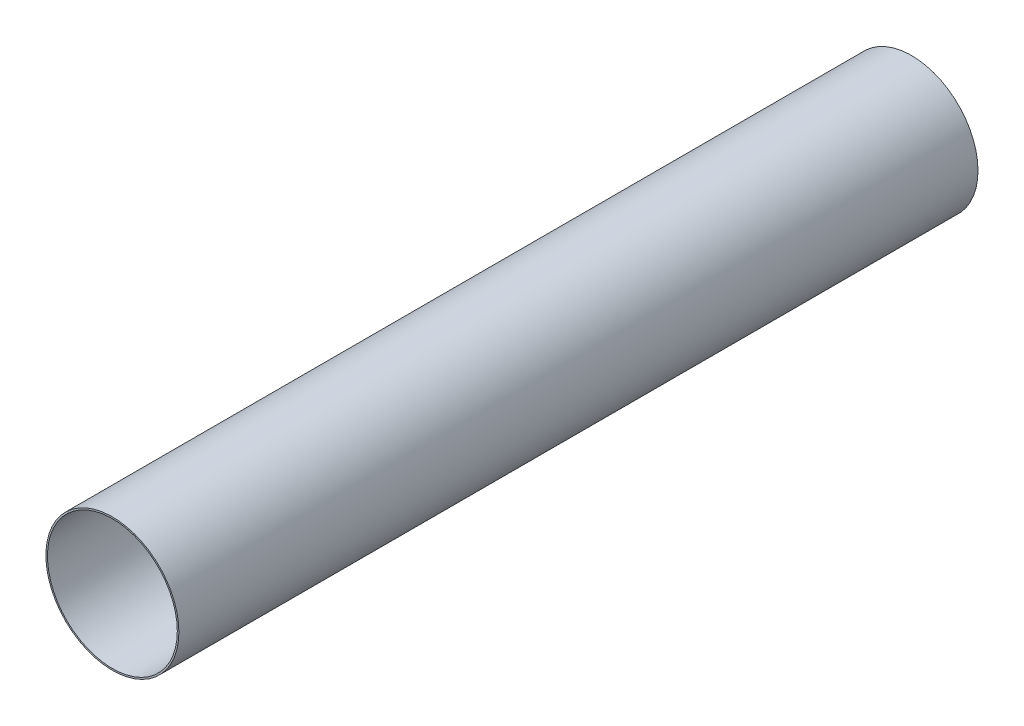
from build123d import *

# Parameters (mm, degrees)
SKETCH1_R           = 84.55
SKETCH1_R_2         = 82.55
BOSS_EXTRUDE1_DEPTH = 508


with BuildPart() as part:
    # Sketch1 → Boss-Extrude1 (new, symmetric)
    with BuildSketch(Plane.XY):
        Circle(SKETCH1_R)
        Circle(SKETCH1_R_2, mode=Mode.SUBTRACT)
    extrude(amount=BOSS_EXTRUDE1_DEPTH, both=True)


solid = part.part
